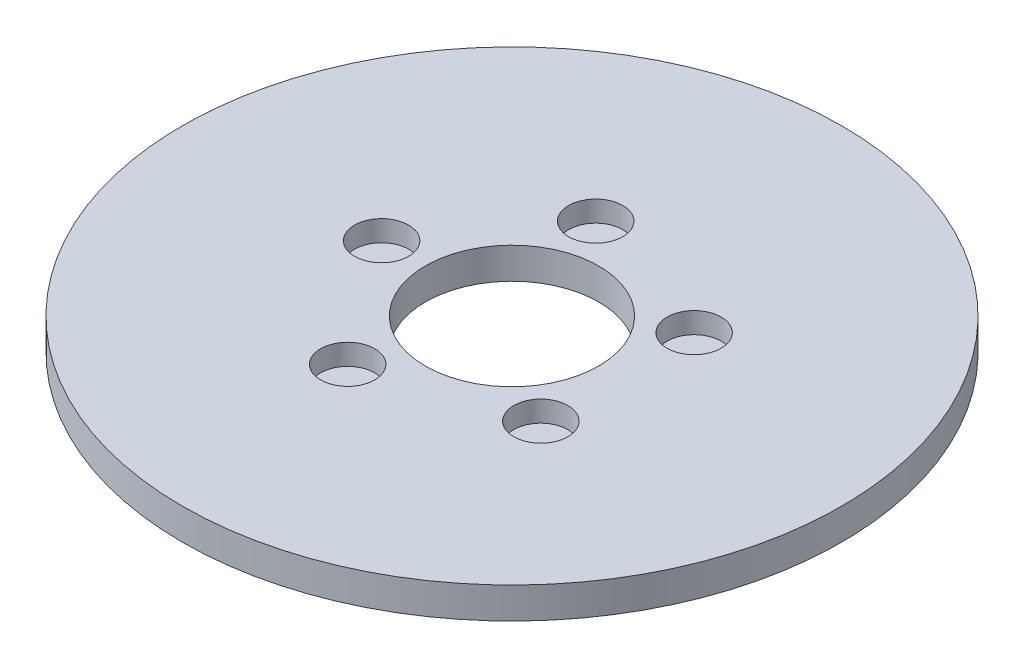
from build123d import *

# Parameters (mm, degrees)
SKETCH1_R           = 95
BOSS_EXTRUDE1_DEPTH = 9
SKETCH2_R           = 25
CUT_EXTRUDE1_DEPTH  = 135.651401775
SKETCH3_R           = 7.797961819
CUT_EXTRUDE2_DEPTH  = 6.025252119
CIRPATTERN1_COUNT   = 5


with BuildPart() as part:
    # Sketch1 → Boss-Extrude1 (new body)
    with BuildSketch(Plane(origin=(0, 0, 0), x_dir=(1, 0, 0), z_dir=(0, 1, 0))):
        Circle(SKETCH1_R)
    extrude(amount=BOSS_EXTRUDE1_DEPTH)

    # Sketch2 → Cut-Extrude1 (cut, through all)
    with BuildSketch(Plane(origin=(0, 0, 0), x_dir=(1, 0, 0), z_dir=(0, 1, 0))):
        Circle(SKETCH2_R)
    extrude(amount=CUT_EXTRUDE1_DEPTH, mode=Mode.SUBTRACT)

    # Sketch3 → Cut-Extrude2 (cut)
    with BuildSketch(Plane(origin=(0, 9, 0), x_dir=(1, 0, 0), z_dir=(0, 1, 0))):
        with Locations((-37.588037911, 0)):
            Circle(SKETCH3_R)
    cut_extrude2 = extrude(amount=-CUT_EXTRUDE2_DEPTH, mode=Mode.SUBTRACT)

    # CirPattern1: Cut-Extrude2 ×5 about axis
    cirpattern1_axis = Axis((0, 0, 0), (0, 1, 0))
    for i in range(1, CIRPATTERN1_COUNT):
        add(cut_extrude2.rotate(cirpattern1_axis, i * 360 / CIRPATTERN1_COUNT), mode=Mode.SUBTRACT)


solid = part.part
